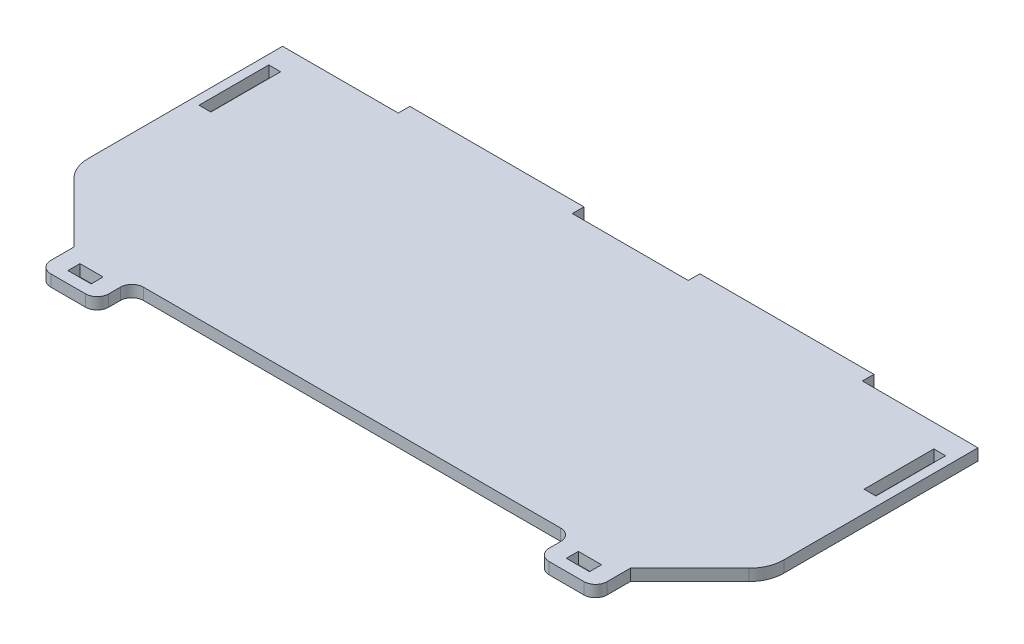
from build123d import *

# Parameters (mm, degrees)
BODY_MOVE_COPY1_START         = -65
BODY_MOVE_COPY1_OUTLINE_W     = 5.1
BODY_MOVE_COPY1_OUTLINE_H     = 30.1
BODY_MOVE_COPY1_OUTLINE_R     = 2.6
BODY_MOVE_COPY1_OUTLINE_R_2   = 3.1
BODY_MOVE_COPY1_OUTLINE_R_3   = 1.55
BODY_MOVE_COPY1_OUTLINE_W_2   = 30.5
BODY_MOVE_COPY1_OUTLINE_H_2   = 14.5
BODY_MOVE_COPY1_DEPTH         = 5
BODY_MOVE_COPY1_START_2       = -5
BODY_MOVE_COPY1_2_OUTLINE_W   = 10
BODY_MOVE_COPY1_2_OUTLINE_H   = 5.2
BODY_MOVE_COPY1_2_OUTLINE_R   = 1.6
BODY_MOVE_COPY1_2_OUTLINE_W_2 = 5.1
BODY_MOVE_COPY1_2_OUTLINE_H_2 = 30.1
BODY_MOVE_COPY1_2_DEPTH       = 5
SKETCH26_W                    = 10
SKETCH26_H                    = 5.2
BOSS_EXTRUDE2_DEPTH           = 5
SKETCH28_W                    = 5.1
SKETCH28_H                    = 30.1
CUT_EXTRUDE1_DEPTH            = 349.066085679


# Read off the part's stored shape, not the designer's step: Body-Move/Copy1
with BuildPart() as part:
    # Body-Move/Copy1 outline → Body-Move/Copy1 (new body)
    with BuildSketch(Plane.XY.offset(BODY_MOVE_COPY1_START)):
        Polygon((24.9, -310), (24.9, -305), (100.2, -305), (100.2, -310), (150, -310), (150, -5), (10.65, -5), (10.65, 0), (-10.65, 0), (-10.65, -5), (-150, -5), (-150, -310), (-100.2, -310), (-100.2, -305), (-24.9, -305), (-24.9, -310), align=None)
        with Locations((-143.45, -280)):
            Rectangle(BODY_MOVE_COPY1_OUTLINE_W, BODY_MOVE_COPY1_OUTLINE_H, mode=Mode.SUBTRACT)
        with Locations((-90, -157.5)):
            Circle(BODY_MOVE_COPY1_OUTLINE_R, mode=Mode.SUBTRACT)
        with Locations((-60, -157.5)):
            Circle(BODY_MOVE_COPY1_OUTLINE_R, mode=Mode.SUBTRACT)
        with Locations((143.45, -280)):
            Rectangle(BODY_MOVE_COPY1_OUTLINE_W, BODY_MOVE_COPY1_OUTLINE_H, mode=Mode.SUBTRACT)
        with Locations((65, -157.5)):
            Circle(BODY_MOVE_COPY1_OUTLINE_R_2, mode=Mode.SUBTRACT)
        with Locations((85, -157.5)):
            Circle(BODY_MOVE_COPY1_OUTLINE_R_2, mode=Mode.SUBTRACT)
        with Locations((-90, -137.5)):
            Circle(BODY_MOVE_COPY1_OUTLINE_R_3, mode=Mode.SUBTRACT)
        with Locations((-60, -137.5)):
            Circle(BODY_MOVE_COPY1_OUTLINE_R_3, mode=Mode.SUBTRACT)
        with Locations((-75, -100.25)):
            Rectangle(BODY_MOVE_COPY1_OUTLINE_W_2, BODY_MOVE_COPY1_OUTLINE_H_2, mode=Mode.SUBTRACT)
        with Locations((-143.45, -30)):
            Rectangle(BODY_MOVE_COPY1_OUTLINE_W, BODY_MOVE_COPY1_OUTLINE_H, mode=Mode.SUBTRACT)
        with Locations((143.45, -30)):
            Rectangle(BODY_MOVE_COPY1_OUTLINE_W, BODY_MOVE_COPY1_OUTLINE_H, mode=Mode.SUBTRACT)
    extrude(amount=BODY_MOVE_COPY1_DEPTH)


with BuildPart() as body_2:
    # Body-Move_Copy1 2 outline → Body-Move_Copy1 2 (new body)
    with BuildSketch(Plane(origin=(0, 0, 0), x_dir=(1, 0, 0), z_dir=(0, 1, 0)).offset(BODY_MOVE_COPY1_START_2)):
        with BuildLine():
            ThreePointArc((-95, -65), (-93.535533906, -61.464466094), (-90, -60))
            Line((-90, -60), (90, -60))
            ThreePointArc((90, -60), (93.535533906, -61.464466094), (95, -65))
            Line((95, -65), (95, -70))
            ThreePointArc((95, -70), (96.464466094, -73.535533906), (100, -75))
            Line((100, -75), (115, -75))
            ThreePointArc((115, -75), (118.535533906, -73.535533906), (120, -70))
            Line((120, -70), (120, -60))
            Line((120, -60), (145.606601718, -34.393398282))
            ThreePointArc((145.606601718, -34.393398282), (148.858192988, -29.52704805), (150, -23.786796564))
            Line((150, -23.786796564), (150, 65))
            Line((150, 65), (10.75, 65))
            Line((10.75, 65), (10.75, 60))
            Line((10.75, 60), (-10.75, 60))
            Line((-10.75, 60), (-10.75, 65))
            Line((-10.75, 65), (-150, 65))
            Line((-150, 65), (-150, -23.786796564))
            ThreePointArc((-150, -23.786796564), (-148.858192988, -29.52704805), (-145.606601718, -34.393398282))
            Line((-145.606601718, -34.393398282), (-120, -60))
            Line((-120, -60), (-120, -70))
            ThreePointArc((-120, -70), (-118.535533906, -73.535533906), (-115, -75))
            Line((-115, -75), (-100, -75))
            ThreePointArc((-100, -75), (-96.464466094, -73.535533906), (-95, -70))
            Line((-95, -70), (-95, -65))
        make_face()
        with Locations((-107.5, -67.5)):
            Rectangle(BODY_MOVE_COPY1_2_OUTLINE_W, BODY_MOVE_COPY1_2_OUTLINE_H, mode=Mode.SUBTRACT)
        with Locations((-110, -52.5)):
            Circle(BODY_MOVE_COPY1_2_OUTLINE_R, mode=Mode.SUBTRACT)
        with Locations((-5, -52.5)):
            Circle(BODY_MOVE_COPY1_2_OUTLINE_R, mode=Mode.SUBTRACT)
        with Locations((5, -52.5)):
            Circle(BODY_MOVE_COPY1_2_OUTLINE_R, mode=Mode.SUBTRACT)
        with Locations((107.5, -67.5)):
            Rectangle(BODY_MOVE_COPY1_2_OUTLINE_W, BODY_MOVE_COPY1_2_OUTLINE_H, mode=Mode.SUBTRACT)
        with Locations((110, -52.5)):
            Circle(BODY_MOVE_COPY1_2_OUTLINE_R, mode=Mode.SUBTRACT)
        with Locations((-143.45, 35)):
            Rectangle(BODY_MOVE_COPY1_2_OUTLINE_W_2, BODY_MOVE_COPY1_2_OUTLINE_H_2, mode=Mode.SUBTRACT)
        with Locations((-110, 52.5)):
            Circle(BODY_MOVE_COPY1_2_OUTLINE_R, mode=Mode.SUBTRACT)
        with Locations((-5, 52.5)):
            Circle(BODY_MOVE_COPY1_2_OUTLINE_R, mode=Mode.SUBTRACT)
        with BuildLine():
            Line((131.606601718, -30.178932188), (115.267766953, -46.517766953))
            ThreePointArc((115.267766953, -46.517766953), (114.456708581, -47.059698831), (113.5, -47.25))
            Line((113.5, -47.25), (107.75, -47.25))
            ThreePointArc((107.75, -47.25), (105.982233047, -47.982233047), (105.25, -49.75))
            Line((105.25, -49.75), (105.25, -53.5))
            ThreePointArc((105.25, -53.5), (104.517766953, -55.267766953), (102.75, -56))
            Line((102.75, -56), (13.25, -56))
            ThreePointArc((13.25, -56), (11.482233047, -55.267766953), (10.75, -53.5))
            Line((10.75, -53.5), (10.75, -49.75))
            ThreePointArc((10.75, -49.75), (10.017766953, -47.982233047), (8.25, -47.25))
            Line((8.25, -47.25), (-8.25, -47.25))
            ThreePointArc((-8.25, -47.25), (-10.017766953, -47.982233047), (-10.75, -49.75))
            Line((-10.75, -49.75), (-10.75, -53.5))
            ThreePointArc((-10.75, -53.5), (-11.482233047, -55.267766953), (-13.25, -56))
            Line((-13.25, -56), (-102.75, -56))
            ThreePointArc((-102.75, -56), (-104.517766953, -55.267766953), (-105.25, -53.5))
            Line((-105.25, -53.5), (-105.25, -49.75))
            ThreePointArc((-105.25, -49.75), (-105.982233047, -47.982233047), (-107.75, -47.25))
            Line((-107.75, -47.25), (-113.5, -47.25))
            ThreePointArc((-113.5, -47.25), (-115.267766953, -46.517766953), (-116, -44.75))
            Line((-116, -44.75), (-116, 44.75))
            ThreePointArc((-116, 44.75), (-115.267766953, 46.517766953), (-113.5, 47.25))
            Line((-113.5, 47.25), (-107.75, 47.25))
            ThreePointArc((-107.75, 47.25), (-105.982233047, 47.982233047), (-105.25, 49.75))
            Line((-105.25, 49.75), (-105.25, 53.5))
            ThreePointArc((-105.25, 53.5), (-104.517766953, 55.267766953), (-102.75, 56))
            Line((-102.75, 56), (-13.25, 56))
            ThreePointArc((-13.25, 56), (-11.482233047, 55.267766953), (-10.75, 53.5))
            Line((-10.75, 53.5), (-10.75, 49.75))
            ThreePointArc((-10.75, 49.75), (-10.017766953, 47.982233047), (-8.25, 47.25))
            Line((-8.25, 47.25), (8.25, 47.25))
            ThreePointArc((8.25, 47.25), (10.017766953, 47.982233047), (10.75, 49.75))
            Line((10.75, 49.75), (10.75, 53.5))
            ThreePointArc((10.75, 53.5), (11.482233047, 55.267766953), (13.25, 56))
            Line((13.25, 56), (102.75, 56))
            ThreePointArc((102.75, 56), (104.517766953, 55.267766953), (105.25, 53.5))
            Line((105.25, 53.5), (105.25, 49.75))
            ThreePointArc((105.25, 49.75), (105.982233047, 47.982233047), (107.75, 47.25))
            Line((107.75, 47.25), (113.5, 47.25))
            ThreePointArc((113.5, 47.25), (115.267766953, 47.982233047), (116, 49.75))
            Line((116, 49.75), (116, 53.5))
            ThreePointArc((116, 53.5), (116.732233047, 55.267766953), (118.5, 56))
            Line((118.5, 56), (133.5, 56))
            ThreePointArc((133.5, 56), (135.267766953, 55.267766953), (136, 53.5))
            Line((136, 53.5), (136, -19.57233047))
            ThreePointArc((136, -19.57233047), (134.858192988, -25.312581956), (131.606601718, -30.178932188))
        make_face(mode=Mode.SUBTRACT)
        with Locations((5, 52.5)):
            Circle(BODY_MOVE_COPY1_2_OUTLINE_R, mode=Mode.SUBTRACT)
        with Locations((143.45, 35)):
            Rectangle(BODY_MOVE_COPY1_2_OUTLINE_W_2, BODY_MOVE_COPY1_2_OUTLINE_H_2, mode=Mode.SUBTRACT)
        with Locations((110, 52.5)):
            Circle(BODY_MOVE_COPY1_2_OUTLINE_R, mode=Mode.SUBTRACT)
    extrude(amount=BODY_MOVE_COPY1_2_DEPTH)


with BuildPart() as body_3:
    # Sketch26 → Boss-Extrude2 (new body)
    with BuildSketch(Plane.XZ.offset(310)):
        with BuildLine():
            Line((-90, 60), (90, 60))
            ThreePointArc((90, 60), (93.535533906, 61.464466094), (95, 65))
            Line((95, 65), (95, 70))
            ThreePointArc((95, 70), (96.464466094, 73.535533906), (100, 75))
            Line((100, 75), (115, 75))
            ThreePointArc((115, 75), (118.535533906, 73.535533906), (120, 70))
            Line((120, 70), (120, 60))
            Line((120, 60), (145.606601718, 34.393398282))
            ThreePointArc((145.606601718, 34.393398282), (148.858192988, 29.52704805), (150, 23.786796564))
            Line((150, 23.786796564), (150, -60))
            Line((150, -60), (100.1, -60))
            Line((100.1, -60), (100.1, -65))
            Line((100.1, -65), (25, -65))
            Line((25, -65), (25, -60))
            Line((25, -60), (-25, -60))
            Line((-25, -60), (-25, -65))
            Line((-25, -65), (-100.1, -65))
            Line((-100.1, -65), (-100.1, -60))
            Line((-100.1, -60), (-150, -60))
            Line((-150, -60), (-150, 23.786796564))
            ThreePointArc((-150, 23.786796564), (-148.858192988, 29.52704805), (-145.606601718, 34.393398282))
            Line((-145.606601718, 34.393398282), (-120, 60))
            Line((-120, 60), (-120, 70))
            ThreePointArc((-120, 70), (-118.535533906, 73.535533906), (-115, 75))
            Line((-115, 75), (-100, 75))
            ThreePointArc((-100, 75), (-96.464466094, 73.535533906), (-95, 70))
            Line((-95, 70), (-95, 65))
            ThreePointArc((-95, 65), (-93.535533906, 61.464466094), (-90, 60))
        make_face()
        with Locations((107.5, 67.5)):
            Rectangle(SKETCH26_W, SKETCH26_H, mode=Mode.SUBTRACT)
        with Locations((-107.5, 67.5)):
            Rectangle(SKETCH26_W, SKETCH26_H, mode=Mode.SUBTRACT)
    extrude(amount=-BOSS_EXTRUDE2_DEPTH)

    # Sketch28 → Cut-Extrude1 (cut, through all)
    with BuildSketch(Plane(origin=(0, -305, 0), x_dir=(1, 0, 0), z_dir=(0, 1, 0))):
        with Locations((143.45, 35)):
            Rectangle(SKETCH28_W, SKETCH28_H)
        with Locations((-143.45, 35)):
            Rectangle(SKETCH28_W, SKETCH28_H)
    extrude(amount=-CUT_EXTRUDE1_DEPTH, mode=Mode.SUBTRACT)


solid = body_3.part
